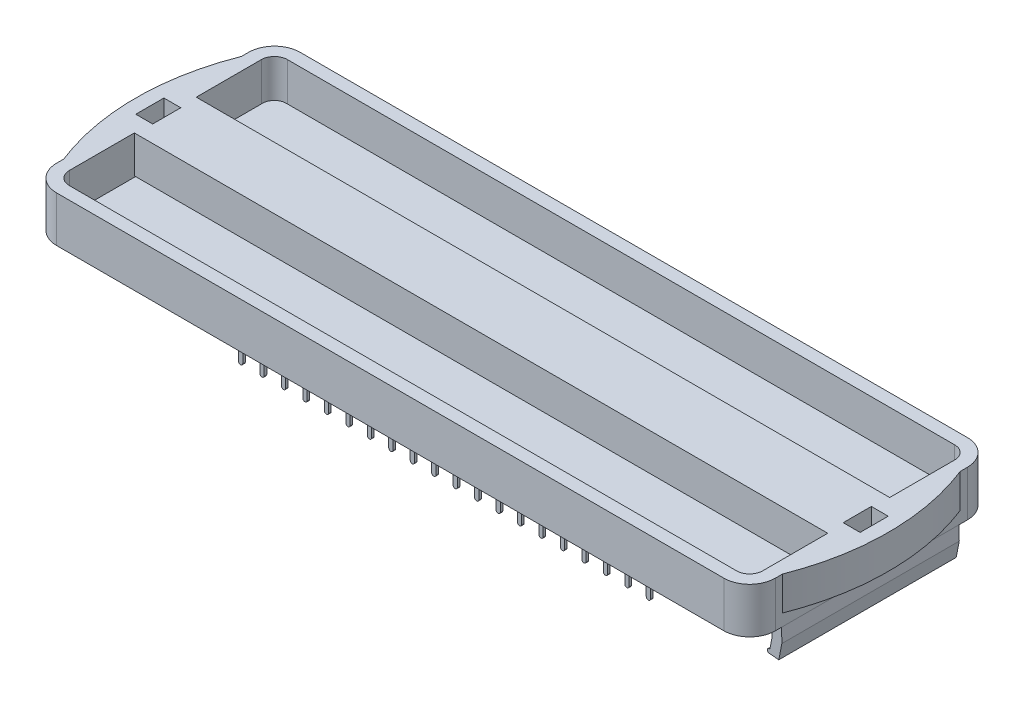
from build123d import *

# Parameters (mm, degrees)
SKETCH1_W                     = 52.32
SKETCH1_H                     = 14.75
BOSS_EXTRUDE1_DEPTH           = 1.875
BOSS_EXTRUDE1_TAPER           = 6
BOSS_EXTRUDE1_OTHER_WAY_DEPTH = 1.875
BOSS_EXTRUDE1_OTHER_WAY_TAPER = 6
SKETCH2_R                     = 0.625
CUT_EXTRUDE1_DEPTH            = 0.35
FILLET1_SIZE                  = 0.35
FILLET1_SIZE_2                = 0.5
SKETCH3_W                     = 9.425447068
SKETCH3_H                     = 1.192626765
SKETCH3_H_2                   = 1.192626766
CUT_EXTRUDE2_DEPTH            = 0.75
BOSS_EXTRUDE2_DEPTH           = 1.67
CUT_EXTRUDE3_DEPTH            = 1.67
LPATTERN1_COUNT               = 20
LPATTERN1_PITCH               = 2.54
PCB_DEPTH                     = 0.8
BOSS_EXTRUDE8_DEPTH           = 1
BOSS_EXTRUDE10_DEPTH          = 1.4
BOSS_EXTRUDE13_DEPTH          = 10.5
BOSS_EXTRUDE13_DEPTH_BACK     = 10.5
BOSS_EXTRUDE13_2_DEPTH        = 10.5
BOSS_EXTRUDE13_2_DEPTH_BACK   = 10.5
BOSS_EXTRUDE14_START          = -7.33
BOSS_EXTRUDE14_DEPTH          = 7.33
BOSS_EXTRUDE15_DEPTH          = 3
BOSS_EXTRUDE16_DEPTH          = 4
SKETCH34_W                    = 2
SKETCH34_H                    = 3.33
CUT_EXTRUDE4_DEPTH            = 3


# Read off the part's stored shape, not the designer's step: Boss-Extrude14
with BuildPart() as part:
    # Sketch1 → Boss-Extrude1 (new body)
    with BuildSketch(Plane(origin=(0, 0, 0), x_dir=(1, 0, 0), z_dir=(0, 1, 0))):
        Rectangle(SKETCH1_W, SKETCH1_H)
    extrude(amount=BOSS_EXTRUDE1_DEPTH, taper=BOSS_EXTRUDE1_TAPER)

    # Sketch1 → Boss-Extrude1 other way (add)
    with BuildSketch(Plane(origin=(0, 0, 0), x_dir=(1, 0, 0), z_dir=(0, 1, 0))):
        Rectangle(SKETCH1_W, SKETCH1_H)
    extrude(amount=-BOSS_EXTRUDE1_OTHER_WAY_DEPTH, taper=BOSS_EXTRUDE1_OTHER_WAY_TAPER)

    # Sketch2 → Cut-Extrude1 (cut)
    with BuildSketch(Plane(origin=(0, 1.875, 0), x_dir=(1, 0, 0), z_dir=(0, 1, 0))):
        with Locations(Location((24.337929559, 5.552929559, 0), (0, 0, 270))):
            Circle(SKETCH2_R)
    extrude(amount=-CUT_EXTRUDE1_DEPTH, mode=Mode.SUBTRACT)

    # Fillet1
    # an asymmetric fillet: 0.5, 0.35 mm, written as the material it adds along each edge
    with BuildSketch(Plane(origin=(24.337929559, 1.525, -5.552929559), x_dir=(0, 0, 1), z_dir=(-1, 0, 0))) as fillet1_piece_1:
        with BuildLine():
            Bezier((0.625, FILLET1_SIZE), (0.625, 0), (0.625 - FILLET1_SIZE_2, 0), weights=[1, 0.707106781, 1])
            Line((0.625 - FILLET1_SIZE_2, 0), (0.625, 0))
            Line((0.625, 0), (0.625, FILLET1_SIZE))
        make_face()
    revolve(axis=Axis((24.337929559, 1.525, -5.552929559), (0, 1, 0)))

    # Sketch3 → Cut-Extrude2 (cut)
    with BuildSketch(Plane(origin=(0, 1.875, 0), x_dir=(1, 0, 0), z_dir=(0, 1, 0))):
        with Locations((30.675653093, 0.528686618)):
            Rectangle(SKETCH3_W, SKETCH3_H)
        with Locations((30.675653093, -0.663940148)):
            Rectangle(SKETCH3_W, SKETCH3_H_2)
        with BuildLine():
            Line((25.962929559, -0.067626765), (24.839964011, -0.067626765))
            ThreePointArc((24.839964011, -0.067626765), (25.143873666, -0.906468445), (25.962929559, -1.260253531))
            Line((25.962929559, -1.260253531), (25.962929559, -0.067626765))
        make_face()
        with BuildLine():
            Line((25.962929559, -0.067626765), (25.962929559, 1.125))
            ThreePointArc((25.962929559, 1.125), (25.143873666, 0.771214915), (24.839964011, -0.067626765))
            Line((24.839964011, -0.067626765), (25.962929559, -0.067626765))
        make_face()
    extrude(amount=-CUT_EXTRUDE2_DEPTH, mode=Mode.SUBTRACT)


with BuildPart() as body_2:
    # Sketch5 → Boss-Extrude2 (new body)
    with BuildSketch(Plane(origin=(0, 0, 0), x_dir=(0, 0, -1), z_dir=(1, 0, 0))):
        with BuildLine():
            Line((6.590230819, 0.15), (7.532975883, 0.15))
            ThreePointArc((7.532975883, 0.15), (7.706864121, 0.079618709), (7.78284453, -0.091896954))
            Line((7.78284453, -0.091896954), (7.875, -2.933638636))
            Line((7.875, -2.933638636), (7.875, -6.183638636))
            Line((7.875, -6.183638636), (7.575, -6.183638636))
            Line((7.575, -6.183638636), (7.575, -2.938501741))
            Line((7.575, -2.938501741), (7.486139966, -0.198379391))
            ThreePointArc((7.486139966, -0.198379391), (7.470943884, -0.164076258), (7.436166236, -0.15))
            Line((7.436166236, -0.15), (6.590230819, -0.15))
            Line((6.590230819, -0.15), (6.590230819, 0.15))
        make_face()
    extrude(amount=BOSS_EXTRUDE2_DEPTH)

    # Sketch6 → Cut-Extrude3 (cut)
    with BuildSketch(Plane(origin=(0, 0, -7.875), x_dir=(-1, 0, 0), z_dir=(0, 0, -1))):
        with BuildLine():
            Line((-1.085, -2.933638636), (-1.085, -5.938638636))
            ThreePointArc((-1.085, -5.938638636), (-1.013241161, -6.111879797), (-0.84, -6.183638636))
            Line((-0.84, -6.183638636), (-0.83, -6.183638636))
            ThreePointArc((-0.83, -6.183638636), (-0.656758839, -6.111879797), (-0.585, -5.938638636))
            Line((-0.585, -5.938638636), (-0.585, -2.933638636))
            Line((-0.585, -2.933638636), (-0.55, -2.933638636))
            ThreePointArc((-0.55, -2.933638636), (-0.16109127, -2.772547365), (0, -2.383638636))
            Line((0, -2.383638636), (0, -0.091896954))
            Line((0, -0.091896954), (1.792240485, -0.091896954))
            Line((1.792240485, -0.091896954), (1.792240485, -6.637804987))
            Line((1.792240485, -6.637804987), (-3.564600504, -6.637804987))
            Line((-3.564600504, -6.637804987), (-3.564600504, -0.091896954))
            Line((-3.564600504, -0.091896954), (-1.67, -0.091896954))
            Line((-1.67, -0.091896954), (-1.67, -2.383638636))
            ThreePointArc((-1.67, -2.383638636), (-1.50890873, -2.772547365), (-1.12, -2.933638636))
            Line((-1.12, -2.933638636), (-1.085, -2.933638636))
        make_face()
    extrude(amount=-CUT_EXTRUDE3_DEPTH, mode=Mode.SUBTRACT)


with BuildPart() as body_2_1:
    # Body-Move/Copy1: moved
    add(body_2.part.moved(Location((23.18, 0, 0))))


with BuildPart() as lpattern1_1:
    # LPattern1: pattern copy
    add(body_2_1.part.moved(Location(Vector(-1, 0, 0) * (1 * LPATTERN1_PITCH))))


with BuildPart() as lpattern1_2:
    # LPattern1: pattern copy
    add(body_2_1.part.moved(Location(Vector(-1, 0, 0) * (2 * LPATTERN1_PITCH))))


with BuildPart() as lpattern1_3:
    # LPattern1: pattern copy
    add(body_2_1.part.moved(Location(Vector(-1, 0, 0) * (3 * LPATTERN1_PITCH))))


with BuildPart() as lpattern1_4:
    # LPattern1: pattern copy
    add(body_2_1.part.moved(Location(Vector(-1, 0, 0) * (4 * LPATTERN1_PITCH))))


with BuildPart() as lpattern1_5:
    # LPattern1: pattern copy
    add(body_2_1.part.moved(Location(Vector(-1, 0, 0) * (5 * LPATTERN1_PITCH))))


with BuildPart() as lpattern1_6:
    # LPattern1: pattern copy
    add(body_2_1.part.moved(Location(Vector(-1, 0, 0) * (6 * LPATTERN1_PITCH))))


with BuildPart() as lpattern1_7:
    # LPattern1: pattern copy
    add(body_2_1.part.moved(Location(Vector(-1, 0, 0) * (7 * LPATTERN1_PITCH))))


with BuildPart() as lpattern1_8:
    # LPattern1: pattern copy
    add(body_2_1.part.moved(Location(Vector(-1, 0, 0) * (8 * LPATTERN1_PITCH))))


with BuildPart() as lpattern1_9:
    # LPattern1: pattern copy
    add(body_2_1.part.moved(Location(Vector(-1, 0, 0) * (9 * LPATTERN1_PITCH))))


with BuildPart() as lpattern1_10:
    # LPattern1: pattern copy
    add(body_2_1.part.moved(Location(Vector(-1, 0, 0) * (10 * LPATTERN1_PITCH))))


with BuildPart() as lpattern1_11:
    # LPattern1: pattern copy
    add(body_2_1.part.moved(Location(Vector(-1, 0, 0) * (11 * LPATTERN1_PITCH))))


with BuildPart() as lpattern1_12:
    # LPattern1: pattern copy
    add(body_2_1.part.moved(Location(Vector(-1, 0, 0) * (12 * LPATTERN1_PITCH))))


with BuildPart() as lpattern1_13:
    # LPattern1: pattern copy
    add(body_2_1.part.moved(Location(Vector(-1, 0, 0) * (13 * LPATTERN1_PITCH))))


with BuildPart() as lpattern1_14:
    # LPattern1: pattern copy
    add(body_2_1.part.moved(Location(Vector(-1, 0, 0) * (14 * LPATTERN1_PITCH))))


with BuildPart() as lpattern1_15:
    # LPattern1: pattern copy
    add(body_2_1.part.moved(Location(Vector(-1, 0, 0) * (15 * LPATTERN1_PITCH))))


with BuildPart() as lpattern1_16:
    # LPattern1: pattern copy
    add(body_2_1.part.moved(Location(Vector(-1, 0, 0) * (16 * LPATTERN1_PITCH))))


with BuildPart() as lpattern1_17:
    # LPattern1: pattern copy
    add(body_2_1.part.moved(Location(Vector(-1, 0, 0) * (17 * LPATTERN1_PITCH))))


with BuildPart() as lpattern1_18:
    # LPattern1: pattern copy
    add(body_2_1.part.moved(Location(Vector(-1, 0, 0) * (18 * LPATTERN1_PITCH))))


with BuildPart() as lpattern1_19:
    # LPattern1: pattern copy
    add(body_2_1.part.moved(Location(Vector(-1, 0, 0) * (19 * LPATTERN1_PITCH))))


with BuildPart() as body_22:
    # Mirror3: mirrored copy
    add(lpattern1_1.part.mirror(Plane.XY))


with BuildPart() as body_23:
    # Mirror3 2: mirrored copy
    add(lpattern1_19.part.mirror(Plane.XY))


with BuildPart() as body_24:
    # Mirror3 3: mirrored copy
    add(lpattern1_18.part.mirror(Plane.XY))


with BuildPart() as body_25:
    # Mirror3 4: mirrored copy
    add(lpattern1_17.part.mirror(Plane.XY))


with BuildPart() as body_26:
    # Mirror3 5: mirrored copy
    add(lpattern1_16.part.mirror(Plane.XY))


with BuildPart() as body_27:
    # Mirror3 6: mirrored copy
    add(lpattern1_15.part.mirror(Plane.XY))


with BuildPart() as body_28:
    # Mirror3 7: mirrored copy
    add(lpattern1_14.part.mirror(Plane.XY))


with BuildPart() as body_29:
    # Mirror3 8: mirrored copy
    add(lpattern1_13.part.mirror(Plane.XY))


with BuildPart() as body_30:
    # Mirror3 9: mirrored copy
    add(lpattern1_12.part.mirror(Plane.XY))


with BuildPart() as body_31:
    # Mirror3 10: mirrored copy
    add(lpattern1_11.part.mirror(Plane.XY))


with BuildPart() as body_32:
    # Mirror3 11: mirrored copy
    add(lpattern1_10.part.mirror(Plane.XY))


with BuildPart() as body_33:
    # Mirror3 12: mirrored copy
    add(lpattern1_9.part.mirror(Plane.XY))


with BuildPart() as body_34:
    # Mirror3 13: mirrored copy
    add(lpattern1_8.part.mirror(Plane.XY))


with BuildPart() as body_35:
    # Mirror3 14: mirrored copy
    add(lpattern1_7.part.mirror(Plane.XY))


with BuildPart() as body_36:
    # Mirror3 15: mirrored copy
    add(lpattern1_6.part.mirror(Plane.XY))


with BuildPart() as body_37:
    # Mirror3 16: mirrored copy
    add(lpattern1_5.part.mirror(Plane.XY))


with BuildPart() as body_38:
    # Mirror3 17: mirrored copy
    add(lpattern1_4.part.mirror(Plane.XY))


with BuildPart() as body_39:
    # Mirror3 18: mirrored copy
    add(lpattern1_3.part.mirror(Plane.XY))


with BuildPart() as body_40:
    # Mirror3 19: mirrored copy
    add(lpattern1_2.part.mirror(Plane.XY))


with BuildPart() as body_41:
    # Mirror3 20: mirrored copy
    add(body_2_1.part.mirror(Plane.XY))


with BuildPart() as lpattern1_15_1:
    add(lpattern1_15.part)

    # Combine1: union body 24, LPattern1_17, body 34, part, LPattern1_19, LPattern1_2, body 31, body 2, body 41, LPattern1_4, LPattern1_6, body 28, body 38, LPattern1_8, body 25, LPattern1_10, body 35, LPattern1_12, body 22, body 32, LPattern1_14, LPattern1_16, body 29, body 39, LPattern1_18, LPattern1_1, body 26, LPattern1_3, body 36, LPattern1_5, body 23, body 33, LPattern1_7, LPattern1_9, body 30, body 40, LPattern1_11, LPattern1_13, body 27, body 37
    add(body_24.part)
    add(lpattern1_17.part)
    add(body_34.part)
    add(part.part)
    add(lpattern1_19.part)
    add(lpattern1_2.part)
    add(body_31.part)
    add(body_2_1.part)
    add(body_41.part)
    add(lpattern1_4.part)
    add(lpattern1_6.part)
    add(body_28.part)
    add(body_38.part)
    add(lpattern1_8.part)
    add(body_25.part)
    add(lpattern1_10.part)
    add(body_35.part)
    add(lpattern1_12.part)
    add(body_22.part)
    add(body_32.part)
    add(lpattern1_14.part)
    add(lpattern1_16.part)
    add(body_29.part)
    add(body_39.part)
    add(lpattern1_18.part)
    add(lpattern1_1.part)
    add(body_26.part)
    add(lpattern1_3.part)
    add(body_36.part)
    add(lpattern1_5.part)
    add(body_23.part)
    add(body_33.part)
    add(lpattern1_7.part)
    add(lpattern1_9.part)
    add(body_30.part)
    add(body_40.part)
    add(lpattern1_11.part)
    add(lpattern1_13.part)
    add(body_27.part)
    add(body_37.part)


with BuildPart() as body_2_2:
    # Sketch15 → PCB (new body)
    with BuildSketch(Plane(origin=(0, 1.875, 0), x_dir=(1, 0, 0), z_dir=(0, 1, 0))):
        with BuildLine():
            Line((-39.493, 12.7635), (39.493, 12.7635))
            ThreePointArc((39.493, 12.7635), (40.480828173, 12.354328173), (40.89, 11.3665))
            Line((40.89, 11.3665), (40.89, 2.1))
            Line((40.89, 2.1), (38.89, 2.1))
            Line((38.89, 2.1), (38.89, -2.1))
            Line((38.89, -2.1), (40.89, -2.1))
            Line((40.89, -2.1), (40.89, -11.3665))
            ThreePointArc((40.89, -11.3665), (40.480828173, -12.354328173), (39.493, -12.7635))
            Line((39.493, -12.7635), (-39.493, -12.7635))
            ThreePointArc((-39.493, -12.7635), (-40.480828173, -12.354328173), (-40.89, -11.3665))
            Line((-40.89, -11.3665), (-40.89, -2.1))
            Line((-40.89, -2.1), (-38.89, -2.1))
            Line((-38.89, -2.1), (-38.89, 2.1))
            Line((-38.89, 2.1), (-40.89, 2.1))
            Line((-40.89, 2.1), (-40.89, 11.3665))
            ThreePointArc((-40.89, 11.3665), (-40.480828173, 12.354328173), (-39.493, 12.7635))
        make_face()
    extrude(amount=PCB_DEPTH)


with BuildPart() as body_3:
    # Sketch17 → Boss-Extrude8 (new body)
    with BuildSketch(Plane(origin=(0, 2.675, 0), x_dir=(1, 0, 0), z_dir=(0, 1, 0))):
        with BuildLine():
            Line((-42.54, 0.45), (-42.54, -0.45))
            Line((-42.54, -0.45), (-42.54, -11.3665))
            ThreePointArc((-42.54, -11.3665), (-41.647554362, -13.521054362), (-39.493, -14.4135))
            Line((-39.493, -14.4135), (39.493, -14.4135))
            ThreePointArc((39.493, -14.4135), (41.647554362, -13.521054362), (42.54, -11.3665))
            Line((42.54, -11.3665), (42.54, -0.45))
            Line((42.54, -0.45), (42.54, 0.45))
            Line((42.54, 0.45), (42.54, 11.3665))
            ThreePointArc((42.54, 11.3665), (41.647554362, 13.521054362), (39.493, 14.4135))
            Line((39.493, 14.4135), (-39.493, 14.4135))
            ThreePointArc((-39.493, 14.4135), (-41.647554362, 13.521054362), (-42.54, 11.3665))
            Line((-42.54, 11.3665), (-42.54, 0.45))
        make_face()
        with BuildLine():
            Line((39.04, 1.95), (41.04, 1.95))
            Line((41.04, 1.95), (41.04, 11.3665))
            ThreePointArc((41.04, 11.3665), (40.58689419, 12.46039419), (39.493, 12.9135))
            Line((39.493, 12.9135), (-39.493, 12.9135))
            ThreePointArc((-39.493, 12.9135), (-40.58689419, 12.46039419), (-41.04, 11.3665))
            Line((-41.04, 11.3665), (-41.04, 1.95))
            Line((-41.04, 1.95), (-39.04, 1.95))
            Line((-39.04, 1.95), (-39.04, -1.95))
            Line((-39.04, -1.95), (-41.04, -1.95))
            Line((-41.04, -1.95), (-41.04, -11.3665))
            ThreePointArc((-41.04, -11.3665), (-40.58689419, -12.46039419), (-39.493, -12.9135))
            Line((-39.493, -12.9135), (39.493, -12.9135))
            ThreePointArc((39.493, -12.9135), (40.58689419, -12.46039419), (41.04, -11.3665))
            Line((41.04, -11.3665), (41.04, -1.95))
            Line((41.04, -1.95), (39.04, -1.95))
            Line((39.04, -1.95), (39.04, 1.95))
        make_face(mode=Mode.SUBTRACT)
    extrude(amount=-BOSS_EXTRUDE8_DEPTH)

    # Sketch18 → Boss-Extrude10 (add)
    # profile 1 of 2: a face of its own
    with BuildSketch(Plane(origin=(0, 2.675, 0), x_dir=(1, 0, 0), z_dir=(0, 1, 0))):
        with BuildLine():
            ThreePointArc((39.493, -14.4135), (41.647554362, -13.521054362), (42.54, -11.3665))
            Line((42.54, -11.3665), (42.54, 11.3665))
            ThreePointArc((42.54, 11.3665), (41.647554362, 13.521054362), (39.493, 14.4135))
            Line((39.493, 14.4135), (-39.493, 14.4135))
            ThreePointArc((-39.493, 14.4135), (-41.647554362, 13.521054362), (-42.54, 11.3665))
            Line((-42.54, 11.3665), (-42.54, -11.3665))
            ThreePointArc((-42.54, -11.3665), (-41.647554362, -13.521054362), (-39.493, -14.4135))
            Line((-39.493, -14.4135), (39.493, -14.4135))
        make_face()
        with BuildLine():
            Line((-41.04, 1.95), (-41.04, 3.665))
            Line((-41.04, 3.665), (-41.04, 11.3665))
            ThreePointArc((-41.04, 11.3665), (-40.58689419, 12.46039419), (-39.493, 12.9135))
            Line((-39.493, 12.9135), (39.493, 12.9135))
            ThreePointArc((39.493, 12.9135), (40.58689419, 12.46039419), (41.04, 11.3665))
            Line((41.04, 11.3665), (41.04, 3.665))
            Line((41.04, 3.665), (41.04, 1.95))
            Line((41.04, 1.95), (39.04, 1.95))
            Line((39.04, 1.95), (39.04, -1.95))
            Line((39.04, -1.95), (41.04, -1.95))
            Line((41.04, -1.95), (41.04, -3.665))
            Line((41.04, -3.665), (41.04, -11.3665))
            ThreePointArc((41.04, -11.3665), (40.58689419, -12.46039419), (39.493, -12.9135))
            Line((39.493, -12.9135), (-39.493, -12.9135))
            ThreePointArc((-39.493, -12.9135), (-40.58689419, -12.46039419), (-41.04, -11.3665))
            Line((-41.04, -11.3665), (-41.04, -3.665))
            Line((-41.04, -3.665), (-41.04, -1.95))
            Line((-41.04, -1.95), (-39.04, -1.95))
            Line((-39.04, -1.95), (-39.04, 1.95))
            Line((-39.04, 1.95), (-41.04, 1.95))
        make_face(mode=Mode.SUBTRACT)
    # profile 2 of 2: a face of its own
    with BuildSketch(Plane(origin=(0, 2.675, 0), x_dir=(1, 0, 0), z_dir=(0, 1, 0))):
        Polygon((41.04, 3.665), (-41.04, 3.665), (-41.04, 1.95), (-39.04, 1.95), (-39.04, -1.95), (-41.04, -1.95), (-41.04, -3.665), (41.04, -3.665), (41.04, -1.95), (39.04, -1.95), (39.04, 1.95), (41.04, 1.95), align=None)
    extrude(amount=BOSS_EXTRUDE10_DEPTH)

    # Boss-Extrude14 outline → Boss-Extrude14 (add)
    with BuildSketch(Plane.XY.offset(3.665).offset(BOSS_EXTRUDE14_START)):
        with BuildLine():
            Line((14.981238267, 2.675), (-14.981238267, 2.675))
            ThreePointArc((-14.981238267, 2.675), (0, 1.925), (14.981238267, 2.675))
        make_face()
    extrude(amount=BOSS_EXTRUDE14_DEPTH)

    # Sketch28 → Boss-Extrude15 (add)
    with BuildSketch(Plane(origin=(0, 4.075, 0), x_dir=(1, 0, 0), z_dir=(0, 1, 0))):
        with BuildLine():
            Line((42.54, -11.3665), (42.54, 11.3665))
            ThreePointArc((42.54, 11.3665), (41.647554362, 13.521054362), (39.493, 14.4135))
            Line((39.493, 14.4135), (-39.493, 14.4135))
            ThreePointArc((-39.493, 14.4135), (-41.647554362, 13.521054362), (-42.54, 11.3665))
            Line((-42.54, 11.3665), (-42.54, -11.3665))
            ThreePointArc((-42.54, -11.3665), (-41.647554362, -13.521054362), (-39.493, -14.4135))
            Line((-39.493, -14.4135), (39.493, -14.4135))
            ThreePointArc((39.493, -14.4135), (41.647554362, -13.521054362), (42.54, -11.3665))
        make_face()
        with BuildLine():
            Line((-41.04, -11.3665), (-41.04, -3.665))
            Line((-41.04, -3.665), (41.04, -3.665))
            Line((41.04, -3.665), (41.04, -11.3665))
            ThreePointArc((41.04, -11.3665), (40.58689419, -12.46039419), (39.493, -12.9135))
            Line((39.493, -12.9135), (-39.493, -12.9135))
            ThreePointArc((-39.493, -12.9135), (-40.58689419, -12.46039419), (-41.04, -11.3665))
        make_face(mode=Mode.SUBTRACT)
        with BuildLine():
            Line((41.04, 11.3665), (41.04, 3.665))
            Line((41.04, 3.665), (-41.04, 3.665))
            Line((-41.04, 3.665), (-41.04, 11.3665))
            ThreePointArc((-41.04, 11.3665), (-40.58689419, 12.46039419), (-39.493, 12.9135))
            Line((-39.493, 12.9135), (39.493, 12.9135))
            ThreePointArc((39.493, 12.9135), (40.58689419, 12.46039419), (41.04, 11.3665))
        make_face(mode=Mode.SUBTRACT)
    extrude(amount=BOSS_EXTRUDE15_DEPTH)

    # Sketch33 → Boss-Extrude16 (add)
    with BuildSketch(Plane(origin=(0, 7.075, 0), x_dir=(1, 0, 0), z_dir=(0, 1, 0))):
        with BuildLine():
            Line((-41.29, -10.5), (-41.29, 10.5))
            Line((-41.29, 10.5), (-42.548132766, 10.5))
            ThreePointArc((-42.548132766, 10.5), (-44.54, 0), (-42.548132766, -10.5))
            Line((-42.548132766, -10.5), (-41.29, -10.5))
        make_face()
        with BuildLine():
            Line((41.29, -10.5), (42.548132766, -10.5))
            ThreePointArc((42.548132766, -10.5), (44.54, 0), (42.548132766, 10.5))
            Line((42.548132766, 10.5), (41.29, 10.5))
            Line((41.29, 10.5), (41.29, -10.5))
        make_face()
    extrude(amount=-BOSS_EXTRUDE16_DEPTH)

    # Sketch34 → Cut-Extrude4 (cut)
    with BuildSketch(Plane(origin=(0, 7.075, 0), x_dir=(1, 0, 0), z_dir=(0, 1, 0))):
        with Locations((-41.869029082, 0)):
            Rectangle(SKETCH34_W, SKETCH34_H)
        with Locations((41.869029082, 0)):
            Rectangle(SKETCH34_W, SKETCH34_H)
    extrude(amount=-CUT_EXTRUDE4_DEPTH, mode=Mode.SUBTRACT)


with BuildPart() as body_4:
    # Sketch20 → Boss-Extrude13 (new, two sides: drawn at the far end of the back side and taken through both)
    with BuildSketch(Plane.XY.offset(-BOSS_EXTRUDE13_DEPTH_BACK)):
        with BuildLine():
            Line((-42.44193432, -0.110962015), (-42.082196773, -1.961651253))
            Line((-42.082196773, -1.961651253), (-40.982327804, -1.865425187))
            Line((-40.982327804, -1.865425187), (-40.930262454, -1.860870059))
            ThreePointArc((-40.930262454, -1.860870059), (-40.732557907, -1.567761014), (-41.025666951, -1.370056467))
            Line((-41.025666951, -1.370056467), (-41.29, -0.010180821))
            Line((-41.29, -0.010180821), (-41.256637909, 1.901132116))
            Line((-41.256637909, 1.901132116), (-42.406462758, 1.921202383))
            Line((-42.406462758, 1.921202383), (-42.44193432, -0.110962015))
        make_face()
    extrude(amount=BOSS_EXTRUDE13_DEPTH + BOSS_EXTRUDE13_DEPTH_BACK)


with BuildPart() as body_5:
    # Sketch20 → Boss-Extrude13 2 (new, two sides: drawn at the far end of the back side and taken through both)
    with BuildSketch(Plane.XY.offset(-BOSS_EXTRUDE13_2_DEPTH_BACK)):
        with BuildLine():
            Line((42.44193432, -0.110962015), (42.406462758, 1.921202383))
            Line((42.406462758, 1.921202383), (41.256637909, 1.901132116))
            Line((41.256637909, 1.901132116), (41.29, -0.010180821))
            Line((41.29, -0.010180821), (41.025666951, -1.370056467))
            ThreePointArc((41.025666951, -1.370056467), (40.732557907, -1.567761014), (40.930262454, -1.860870059))
            Line((40.930262454, -1.860870059), (40.982327804, -1.865425187))
            Line((40.982327804, -1.865425187), (42.082196773, -1.961651253))
            Line((42.082196773, -1.961651253), (42.44193432, -0.110962015))
        make_face()
    extrude(amount=BOSS_EXTRUDE13_2_DEPTH + BOSS_EXTRUDE13_2_DEPTH_BACK)


solid = Compound([lpattern1_15_1.part, body_2_2.part, body_3.part, body_4.part, body_5.part])
